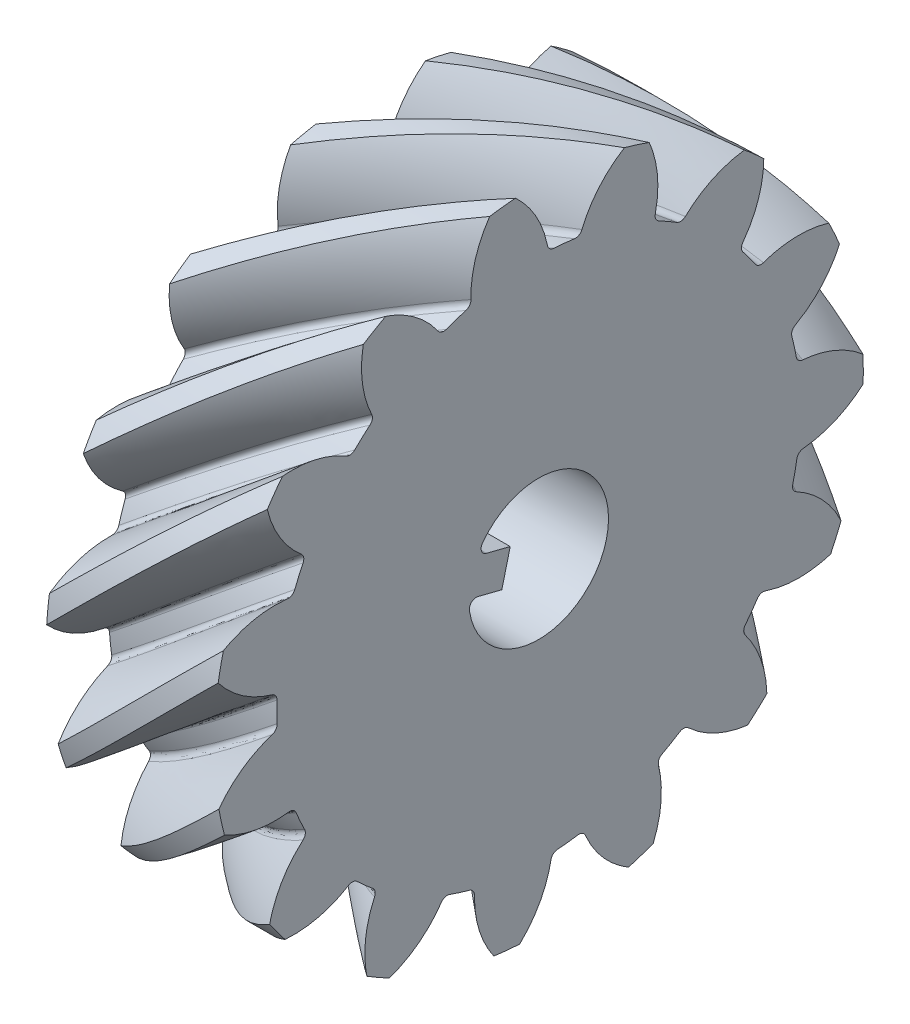
from build123d import *

# Parameters (mm, degrees)
BASPROSKE_W            = 12
BASPROSKE_H            = 23.213203436
TOOTHCUTLH_PITCH       = 145.852858759
TOOTHCUTLH_HEIGHT      = 12
TOOTHCUTLH_RADIUS      = 23.213203436
TOOTHCUTLH_START_ANGLE = -90
TEETHCUTSLH_COUNT      = 15
TEETHCUTSLH_ANGLE      = 336
BORSKE_R               = 5
BORE_DEPTH             = 62.5000025
BOSS_EXTRUDE1_DEPTH    = 12
FILLET1_R              = 0.5


with BuildPart() as part:
    # BasProSke → Base-Revolve (revolve)
    with BuildSketch(Plane(origin=(0, 0, 0), x_dir=(1, 0, 0), z_dir=(0, 1, 0)), mode=Mode.PRIVATE) as base_revolve_sk:
        with Locations((6, 11.606601718)):
            Rectangle(BASPROSKE_W, BASPROSKE_H)
    revolve(base_revolve_sk.sketch.rotate(Axis((-10, 0, 0), (1, 0, 0)), 180), axis=Axis((-10, 0, 0), (1, 0, 0)))

    # ToothCutLH: sweep along a helix
    with BuildLine() as toothcutlh_path:
        add(Helix(TOOTHCUTLH_PITCH, TOOTHCUTLH_HEIGHT, TOOTHCUTLH_RADIUS, center=(0, 0, 0), direction=(1, 0, 0), lefthand=True, mode=Mode.PRIVATE).rotate(Axis((0, 0, 0), (1, 0, 0)), TOOTHCUTLH_START_ANGLE))
    # TooCutSkeRH<3> → ToothCutLH (sweep, cut)
    with BuildSketch(Plane(origin=(0, 0, 0), x_dir=(0, 0, -1), z_dir=(1, 0, 0))):
        with BuildLine():
            ThreePointArc((0.737932466, 18.698648039), (0, 18.713203436), (-0.737932466, 18.698648039))
            ThreePointArc((-0.737932466, 18.698648039), (-1.048225915, 18.791104975), (-1.237176833, 19.05402675))
            ThreePointArc((-1.237176833, 19.05402675), (-2.574531721, 21.584927745), (-4.762692437, 23.430444103))
            ThreePointArc((-4.762692437, 23.430444103), (0, 23.909599539), (4.762692437, 23.430444103))
            ThreePointArc((4.762692437, 23.430444103), (2.574531721, 21.584927745), (1.237176833, 19.05402675))
            ThreePointArc((1.237176833, 19.05402675), (1.048225915, 18.791104975), (0.737932466, 18.698648039))
        make_face()
    toothcutlh = sweep(path=toothcutlh_path.line, is_frenet=True, mode=Mode.SUBTRACT)

    # TeethCutsLH: ToothCutLH ×15 about axis
    teethcutslh_axis = Axis((-10, 0, 0), (1, 0, 0))
    for i in range(1, TEETHCUTSLH_COUNT):
        add(toothcutlh.rotate(teethcutslh_axis, i * TEETHCUTSLH_ANGLE / (TEETHCUTSLH_COUNT - 1)), mode=Mode.SUBTRACT)

    # BorSke → Bore (cut, symmetric)
    with BuildSketch(Plane(origin=(0, 0, 0), x_dir=(0, 0, -1), z_dir=(1, 0, 0))):
        with Locations(Location((0, 0, 0), (0, 0, 180))):
            Circle(BORSKE_R)
    extrude(amount=BORE_DEPTH, both=True, mode=Mode.SUBTRACT)

    # Sketch3 → Boss-Extrude1 (add)
    with BuildSketch(Plane.ZY):
        Polygon((2.026770224, 1.775502155), (2.626847931, -0.599880716), (4.63064896, -0.093673341), (5.739453521, 0.186436828), (5.139375814, 2.561819698), (3.985791432, 2.270397091), align=None)
    extrude(amount=-BOSS_EXTRUDE1_DEPTH)

    # Fillet1
    fillet1_edges = [part.edges().sort_by_distance(p)[0] for p in [
        (6, -0.000366565, 4.999999987),
        (6, 2.375015837, 4.399920428),
    ]]
    fillet(fillet1_edges, radius=FILLET1_R)


solid = part.part
